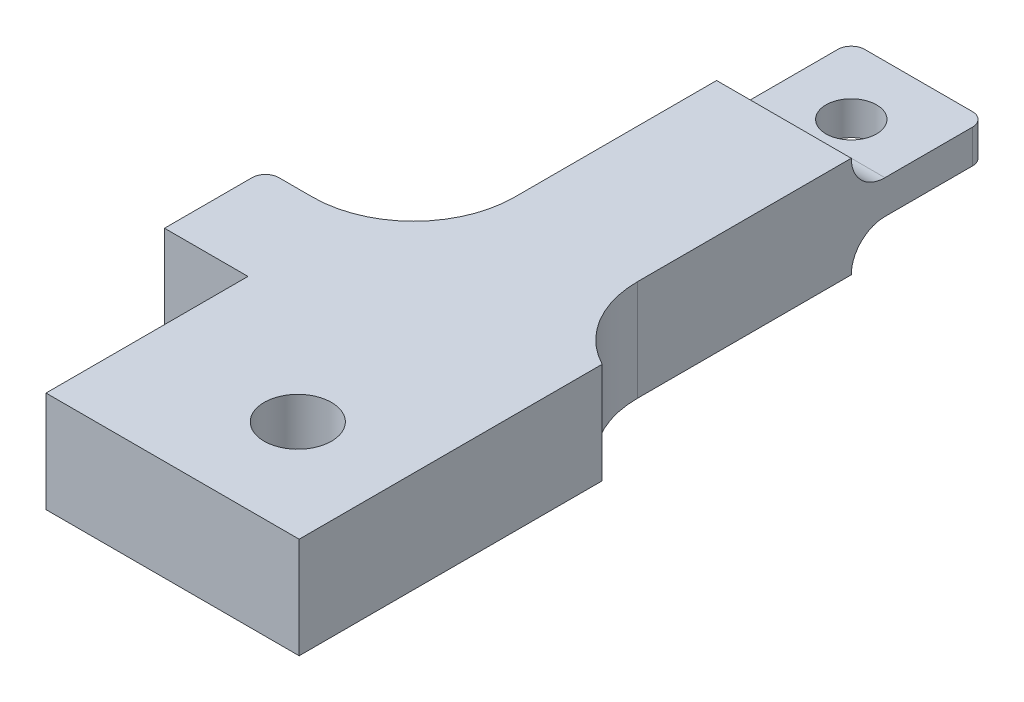
from build123d import *

# Parameters (mm, degrees)
STOCK_DEPTH        = 9.525
MOUNTING_HOLE_D    = 6.35
SPRING_HOLE_D      = 4.7625
FILLET3_R          = 9.525
FILLET4_R          = 1.27
SKETCH15_W         = 12.7
SKETCH15_H         = 12.7
CUT_EXTRUDE1_DEPTH = 3.175
SKETCH16_W         = 12.7
SKETCH16_H         = 12.7
CUT_EXTRUDE2_DEPTH = 3.175
FILLET5_R          = 3.175


# Some blends are built 0.0001 mm under size
with BuildPart() as part:
    # Sketch7 → Stock (new body)
    with BuildSketch(Plane(origin=(0, 0, 0), x_dir=(1, 0, 0), z_dir=(0, 1, 0))):
        Polygon((0, 0), (0, 19.05), (-7.874, 19.05), (-7.874, 28.575), (6.096, 28.575), (6.096, 69.85), (18.796, 69.85), (18.796, 28.575), (23.876, 28.575), (23.876, 0), align=None)
    extrude(amount=STOCK_DEPTH)

    # Mounting Hole (through all)
    with Locations(Plane(origin=(0, 9.525, 0), x_dir=(1, 0, 0), z_dir=(0, 1, 0))):
        with Locations((14.224, 9.525)):
            Hole(MOUNTING_HOLE_D / 2)

    # Spring Hole (through all)
    with Locations(Plane(origin=(0, 9.525, 0), x_dir=(1, 0, 0), z_dir=(0, 1, 0))):
        with Locations((12.446, 63.5)):
            Hole(SPRING_HOLE_D / 2)

    # Fillet3
    # the kernel refuses this fillet: 9.525 mm, written as the material it adds along each edge
    with BuildSketch(Plane(origin=(6.096, 0, -28.575), x_dir=(-1, 0, 0), z_dir=(0, 1, 0))) as fillet3_piece_1:
        with BuildLine():
            CenterArc((FILLET3_R, -FILLET3_R), FILLET3_R, 90, 90)
            Line((0, -FILLET3_R), (-FILLET3_R * 0.02, -FILLET3_R))
            Line((-FILLET3_R * 0.02, -FILLET3_R), (-FILLET3_R * 0.02, FILLET3_R * 0.02))
            Line((-FILLET3_R * 0.02, FILLET3_R * 0.02), (FILLET3_R, FILLET3_R * 0.02))
            Line((FILLET3_R, FILLET3_R * 0.02), (FILLET3_R, 0))
        make_face()
    extrude(amount=9.525)
    with BuildSketch(Plane(origin=(18.796, 0, -28.575), x_dir=(1, 0, 0), z_dir=(0, 1, 0))) as fillet3_piece_2:
        with BuildLine():
            CenterArc((9.525, 8.424226968), FILLET3_R, 180, 62.181860715)
            Line((0, 8.424226968), (-0.1905, 8.424226968))
            Line((-0.1905, 8.424226968), (-0.1905, 0))
            Line((-0.1905, 0), (0, -0.1905))
            ThreePointArc((0, -0.1905), (2.54, -0.1905), (4.9911, -0.168484539))
            Line((4.9911, -0.168484539), (5.08, 0))
        make_face()
    extrude(amount=9.525)

    # Fillet4
    fillet4_edges = [part.edges().sort_by_distance(p)[0] for p in [
        (-7.874, 4.7625, -28.575),
        (6.096, 4.7625, -69.85),
        (18.796, 4.7625, -69.85),
    ]]
    fillet(fillet4_edges, radius=FILLET4_R)

    # Sketch15 → Cut-Extrude1 (cut)
    with BuildSketch(Plane(origin=(0, 9.525, 0), x_dir=(1, 0, 0), z_dir=(0, 1, 0))):
        with Locations((12.446, 63.5)):
            Rectangle(SKETCH15_W, SKETCH15_H)
    extrude(amount=-CUT_EXTRUDE1_DEPTH, mode=Mode.SUBTRACT)

    # Sketch16 → Cut-Extrude2 (cut)
    with BuildSketch(Plane.XZ):
        with Locations((12.446, -63.5)):
            Rectangle(SKETCH16_W, SKETCH16_H)
    extrude(amount=-CUT_EXTRUDE2_DEPTH, mode=Mode.SUBTRACT)

    # Fillet5
    fillet5_edges = [part.edges().sort_by_distance(p)[0] for p in [
        (12.446, 3.175, -57.15),
        (12.446, 6.35, -57.15),
    ]]
    fillet(fillet5_edges, radius=FILLET5_R - 0.0001)  # a hair under: the kernel refuses the full size


solid = part.part
